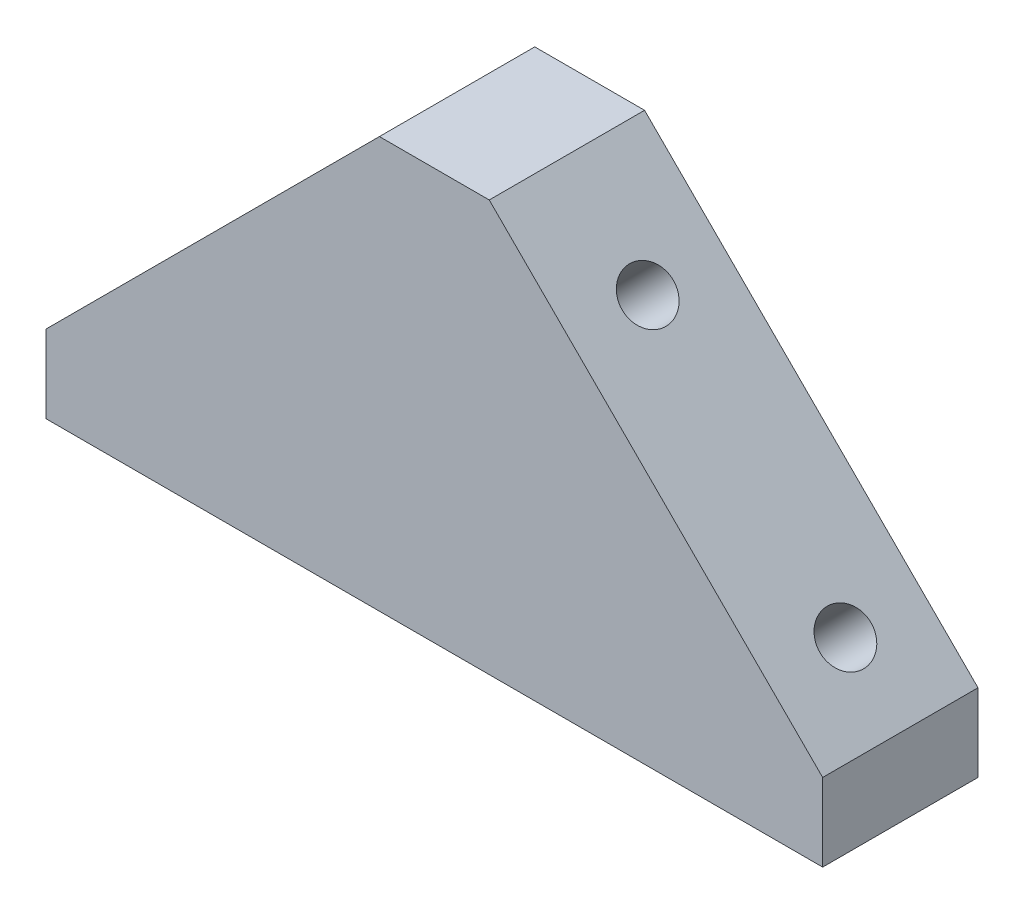
from build123d import *

# Parameters (mm, degrees)
BOSS_EXTRU_1_DEPTH      = 10
ESQUISSE2_R             = 1.65
ENL_V_MAT_EXTRU_1_DEPTH = 8
ESQUISSE3_R             = 1.65
ENL_V_MAT_EXTRU_2_DEPTH = 8
CHANFREIN1_SIZE         = 5
ESQUISSE4_R             = 1.65
ENL_V_MAT_EXTRU_3_DEPTH = 10


with BuildPart() as part:
    # Esquisse1 → Boss.-Extru.1 (new body)
    with BuildSketch(Plane.XY):
        Polygon((-25, 0), (25, 0), (25, 5), (0, 30), (-25, 5), align=None)
    extrude(amount=BOSS_EXTRU_1_DEPTH)

    # Esquisse2 → Enlèv. mat.-Extru.1 (cut)
    with BuildSketch(Plane(origin=(15, 15, 0), x_dir=(0, 0, -1), z_dir=(0.7071067811865511, 0.7071067811865439, 0))):
        with Locations((-5, 8.857864376)):
            Circle(ESQUISSE2_R)
        with Locations((-5, -9.142135624)):
            Circle(ESQUISSE2_R)
    extrude(amount=-ENL_V_MAT_EXTRU_1_DEPTH, mode=Mode.SUBTRACT)

    # Esquisse3 → Enlèv. mat.-Extru.2 (cut)
    with BuildSketch(Plane(origin=(-15, 15, 0), x_dir=(0, 0, 1), z_dir=(-0.7071067811865511, 0.7071067811865439, 0))):
        with Locations((5, 9.857864376)):
            Circle(ESQUISSE3_R)
        with Locations((5, -8.142135624)):
            Circle(ESQUISSE3_R)
    extrude(amount=-ENL_V_MAT_EXTRU_2_DEPTH, mode=Mode.SUBTRACT)

    # Chanfrein1
    chanfrein1_edges = [part.edges().sort_by_distance(p)[0] for p in [
        (0, 30, 5),
    ]]
    chamfer(chanfrein1_edges, length=CHANFREIN1_SIZE)

    # Esquisse4 → Enlèv. mat.-Extru.3 (cut)
    with BuildSketch(Plane.XZ):
        with Locations((0, 5)):
            Circle(ESQUISSE4_R)
        with Locations((-16, 5)):
            Circle(ESQUISSE4_R)
        with Locations((16, 5)):
            Circle(ESQUISSE4_R)
    extrude(amount=-ENL_V_MAT_EXTRU_3_DEPTH, mode=Mode.SUBTRACT)


solid = part.part
